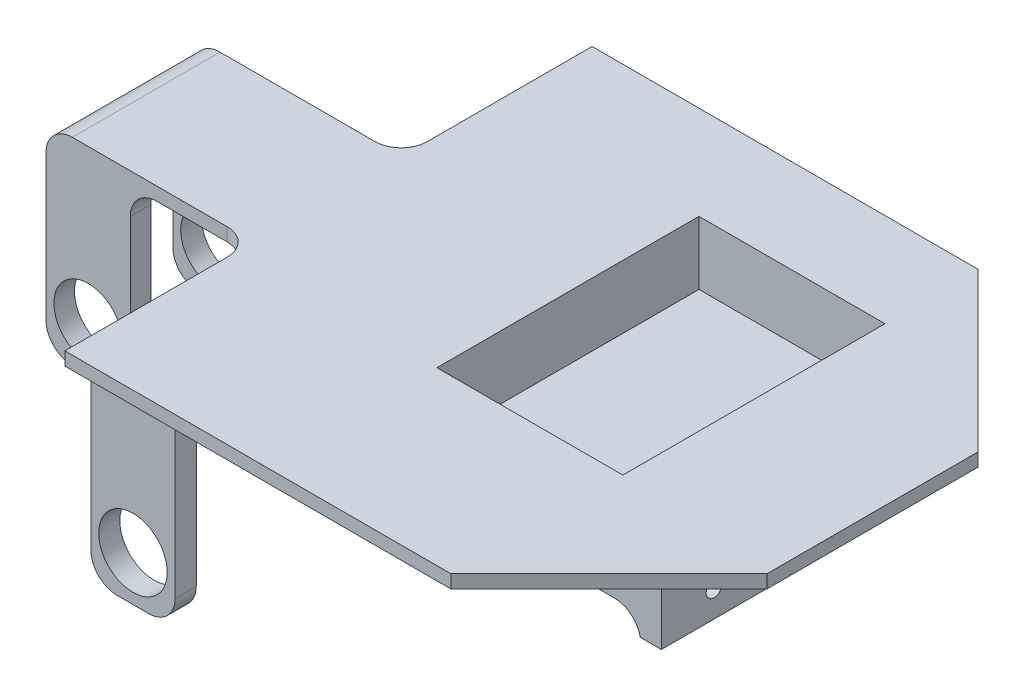
from build123d import *

# Parameters (mm, degrees)
SKETCH1_W               = 200
SKETCH1_H               = 100
BOSS_EXTRUDE1_DEPTH     = 2.5
SKETCH2_W               = 16
SKETCH2_H               = 3.950426225
SKETCH2_H_2             = 3.900095421
SKETCH2_H_3             = 4
BOSS_EXTRUDE2_DEPTH     = 35
CUT_EXTRUDE1_DEPTH      = 39
CUT_EXTRUDE1_DEPTH_BACK = 67
SKETCH3_R               = 6.5
CUT_EXTRUDE2_DEPTH      = 17
FILLET1_R               = 5
SKETCH5_W               = 40.815497855
SKETCH5_H               = 100
CUT_EXTRUDE3_DEPTH      = 17
FILLET2_R               = 5
CHAMFER1_SIZE           = 30
FILLET3_R               = 5
FILLET4_R               = 5
SKETCH6_W               = 47.289599934
SKETCH6_H               = 55
BOSS_EXTRUDE3_DEPTH     = 20
SKETCH7_W               = 39.289599934
SKETCH7_H               = 4
CUT_EXTRUDE4_DEPTH      = 63
FILLET5_R               = 5
SKETCH8_R               = 1.5
CUT_EXTRUDE5_DEPTH      = 63
SKETCH9_W               = 35.271425717
SKETCH9_H               = 49.717701143
CUT_EXTRUDE6_DEPTH      = 12


with BuildPart() as part:
    # Sketch1 → Boss-Extrude1 (new body)
    with BuildSketch(Plane(origin=(0, 0, 0), x_dir=(1, 0, 0), z_dir=(0, 1, 0))):
        Rectangle(SKETCH1_W, SKETCH1_H)
    extrude(amount=BOSS_EXTRUDE1_DEPTH)

    # Sketch2 → Boss-Extrude2 (add)
    with BuildSketch(Plane(origin=(0, 0, 0), x_dir=(-1, 0, 0), z_dir=(0, -1, 0))):
        with Locations((75.379396221, 11.811738969)):
            Rectangle(SKETCH2_W, SKETCH2_H)
        with Locations((75.379396221, -12.263000209)):
            Rectangle(SKETCH2_W, SKETCH2_H_2)
        with Locations((33.379396221, 45.286952081)):
            Rectangle(SKETCH2_W, SKETCH2_H_3)
        with Locations((33.379396221, -45.713047919)):
            Rectangle(SKETCH2_W, SKETCH2_H_3)
    extrude(amount=BOSS_EXTRUDE2_DEPTH)

    # Sketch3 → Cut-Extrude1 (cut, two sides: drawn at the far end of the back side and taken through both)
    with BuildSketch(Plane(origin=(0, 0, -13.786952081), x_dir=(-1, 0, 0), z_dir=(0, 0, -1)).offset(-CUT_EXTRUDE1_DEPTH_BACK)):
        with Locations(Location((33.379396221, -26.491201538, 0), (0, 0, 180))):
            Circle(SKETCH3_R)
        with Locations(Location((75.379396221, -26.491201538, 0), (0, 0, 180))):
            Circle(SKETCH3_R)
    extrude(amount=CUT_EXTRUDE1_DEPTH + CUT_EXTRUDE1_DEPTH_BACK, mode=Mode.SUBTRACT)

    # Sketch4 → Cut-Extrude2 (cut)
    with BuildSketch(Plane(origin=(0, 0, 0), x_dir=(-1, 0, 0), z_dir=(0, -1, 0))):
        Polygon((44.011079662, 50), (100, 50), (100, 13.786952081), (100, -14.213047919), (100, -50), (44.011079662, -50), (44.011079662, -14.213047919), (83.379396221, -14.213047919), (83.379396221, 13.786952081), (44.011079662, 13.786952081), align=None)
    extrude(amount=-CUT_EXTRUDE2_DEPTH, mode=Mode.SUBTRACT)

    # Fillet1
    fillet1_edges = [part.edges().sort_by_distance(p)[0] for p in [
        (-83.379396221, -35, -11.811738968),
        (-67.379396221, -35, -11.811738968),
        (-83.379396221, -35, 12.263000209),
        (-67.379396221, -35, 12.263000209),
        (-41.379396221, -35, -45.286952081),
        (-25.379396221, -35, -45.286952081),
        (-41.379396221, -35, 45.713047919),
        (-25.379396221, -35, 45.713047919),
    ]]
    fillet(fillet1_edges, radius=FILLET1_R)

    # Sketch5 → Cut-Extrude3 (cut)
    with BuildSketch(Plane.XZ):
        with Locations((79.592251073, 0)):
            Rectangle(SKETCH5_W, SKETCH5_H)
    extrude(amount=-CUT_EXTRUDE3_DEPTH, mode=Mode.SUBTRACT)

    # Fillet2
    fillet2_edges = [part.edges().sort_by_distance(p)[0] for p in [
        (-44.011079662, 1.25, -13.786952081),
        (-44.011079662, 1.25, 14.213047919),
    ]]
    fillet(fillet2_edges, radius=FILLET2_R)

    # Chamfer1
    chamfer1_edges = [part.edges().sort_by_distance(p)[0] for p in [
        (59.184502145, 1.25, -50),
        (59.184502145, 1.25, 50),
    ]]
    chamfer(chamfer1_edges, length=CHAMFER1_SIZE)

    # Fillet3
    # the kernel refuses this fillet: 5 mm, written as the material it takes off along each edge
    with BuildSketch(Plane(origin=(-83.379396221, 2.5, -26.286952081), x_dir=(1, 0, 0), z_dir=(0, 0, 1))) as fillet3_piece_1:
        with BuildLine():
            CenterArc((FILLET3_R, -FILLET3_R), FILLET3_R, 90, 90)
            Line((0, -FILLET3_R), (0, 0))
            Line((0, 0), (FILLET3_R, 0))
        make_face()
    extrude(amount=53, mode=Mode.SUBTRACT)

    # Fillet4
    fillet4_edges = [part.edges().sort_by_distance(p)[0] for p in [
        (-67.379396221, 0, -11.811738968),
        (-67.379396221, 0, 12.263000209),
    ]]
    fillet(fillet4_edges, radius=FILLET4_R)

    # Sketch6 → Boss-Extrude3 (add)
    with BuildSketch(Plane.XZ):
        with Locations((15.469477867, -7.508196086)):
            Rectangle(SKETCH6_W, SKETCH6_H)
    extrude(amount=BOSS_EXTRUDE3_DEPTH)

    # Sketch7 → Cut-Extrude4 (cut)
    with BuildSketch(Plane(origin=(0, 0, -35.008196086), x_dir=(-1, 0, 0), z_dir=(0, 0, -1))):
        with Locations((-15.469477867, -18)):
            Rectangle(SKETCH7_W, SKETCH7_H)
    extrude(amount=-CUT_EXTRUDE4_DEPTH, mode=Mode.SUBTRACT)

    # Fillet5
    # the kernel refuses this fillet: 5 mm, written as the material it adds along each edge
    with BuildSketch(Plane(origin=(-4.1753221, -16, -35.008196086), x_dir=(1, 0, 0), z_dir=(0, 0, 1))) as fillet5_piece_1:
        with BuildLine():
            CenterArc((4.898979486, -5), FILLET5_R, 90, 78.463040967)
            Line((0, -4), (-0.09797959, -3.98))
            ThreePointArc((-0.09797959, -3.98), (-0.1, -2), (-0.1, 0))
            Line((-0.1, 0), (0, 0.1))
            Line((0, 0.1), (4.898979486, 0.1))
            Line((4.898979486, 0.1), (4.898979486, 0))
        make_face()
    extrude(amount=55)
    with BuildSketch(Plane(origin=(35.114277834, -16, -35.008196086), x_dir=(-1.570299446029318e-12, -1.0, 0), z_dir=(0, 0, 1))) as fillet5_piece_2:
        with BuildLine():
            CenterArc((5, -4.898979486), FILLET5_R, 101.536959033, 78.463040967)
            Line((0, -4.898979486), (-0.1, -4.898979486))
            Line((-0.1, -4.898979486), (-0.1, 0))
            Line((-0.1, 0), (0, 0.1))
            ThreePointArc((0, 0.1), (2, 0.1), (3.98, 0.09797959))
            Line((3.98, 0.09797959), (4, 0))
        make_face()
    extrude(amount=55)

    # Sketch8 → Cut-Extrude5 (cut)
    with BuildSketch(Plane(origin=(39.114277834, 0, 0), x_dir=(0, 0, -1), z_dir=(1, 0, 0))):
        with Locations((-9.991803914, -15)):
            Circle(SKETCH8_R)
        with Locations((10.008196086, -15)):
            Circle(SKETCH8_R)
        with Locations((0.008196086, -15)):
            Circle(SKETCH8_R)
        with Locations((20.008196086, -15)):
            Circle(SKETCH8_R)
        with Locations((30.008196086, -15)):
            Circle(SKETCH8_R)
    extrude(amount=-CUT_EXTRUDE5_DEPTH, mode=Mode.SUBTRACT)

    # Sketch9 → Cut-Extrude6 (cut)
    with BuildSketch(Plane(origin=(0, 2.5, 0), x_dir=(1, 0, 0), z_dir=(0, 1, 0))):
        with Locations((11.669671686, 7.37138384)):
            Rectangle(SKETCH9_W, SKETCH9_H)
    extrude(amount=-CUT_EXTRUDE6_DEPTH, mode=Mode.SUBTRACT)


solid = part.part
